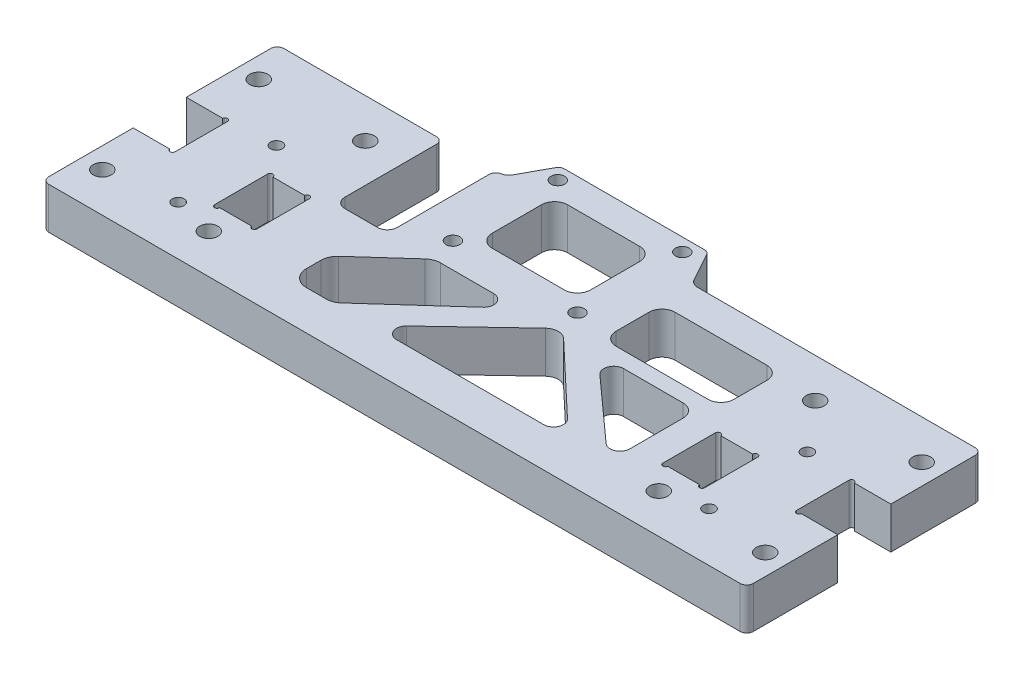
from build123d import *

# Parameters (mm, degrees)
SKETCH1_R           = 2.75
BOSS_EXTRUDE1_DEPTH = 12.7
SKETCH2_W           = 16
SKETCH2_H           = 46.496113018
CUT_EXTRUDE1_DEPTH  = 231.724624824
SKETCH3_R           = 2.1
CUT_EXTRUDE2_DEPTH  = 231.724624824
CUT_EXTRUDE3_DEPTH  = 231.724624824
FILLET1_R           = 3
FILLET2_R           = 2
SKETCH6_R           = 1.8
CUT_EXTRUDE4_DEPTH  = 231.724624958


with BuildPart() as part:
    # Sketch1 → Boss-Extrude1 (new body)
    with BuildSketch(Plane(origin=(0, 0, 0), x_dir=(1, 0, 0), z_dir=(0, 1, 0))):
        with BuildLine():
            Line((0, 71.75), (69.5, 71.75))
            Line((69.5, 71.75), (75.5, 82.75))
            Line((75.5, 82.75), (120.5, 82.75))
            Line((120.5, 82.75), (126.5, 71.75))
            Line((126.5, 71.75), (215, 71.75))
            Line((215, 71.75), (215, 43.975))
            Line((215, 43.975), (203.881088693, 43.975))
            ThreePointArc((203.881088693, 43.975), (203.090544346, 44.652363805), (202.3, 43.975))
            Line((202.3, 43.975), (202.3, 27.775))
            ThreePointArc((202.3, 27.775), (203.090544346, 27.097636195), (203.881088693, 27.775))
            Line((203.881088693, 27.775), (215, 27.775))
            Line((215, 27.775), (215, 0))
            Line((215, 0), (107.5, 0))
            Line((107.5, 0), (0, 0))
            Line((0, 0), (0, 27.775))
            Line((0, 27.775), (11.118911307, 27.775))
            ThreePointArc((11.118911307, 27.775), (11.909455654, 27.097636195), (12.7, 27.775))
            Line((12.7, 27.775), (12.7, 43.975))
            ThreePointArc((12.7, 43.975), (11.909455654, 44.652363805), (11.118911307, 43.975))
            Line((11.118911307, 43.975), (0, 43.975))
            Line((0, 43.975), (0, 71.75))
        make_face()
        with Locations((38.85, 59.75)):
            Circle(SKETCH1_R, mode=Mode.SUBTRACT)
        with Locations((38.85, 12)):
            Circle(SKETCH1_R, mode=Mode.SUBTRACT)
        with Locations((176.15, 59.75)):
            Circle(SKETCH1_R, mode=Mode.SUBTRACT)
        with Locations((176.15, 12)):
            Circle(SKETCH1_R, mode=Mode.SUBTRACT)
        with Locations((6.35, 12)):
            Circle(SKETCH1_R, mode=Mode.SUBTRACT)
        with Locations((6.35, 59.75)):
            Circle(SKETCH1_R, mode=Mode.SUBTRACT)
        with Locations((208.65, 59.75)):
            Circle(SKETCH1_R, mode=Mode.SUBTRACT)
        with Locations((208.65, 12)):
            Circle(SKETCH1_R, mode=Mode.SUBTRACT)
        with BuildLine():
            Line((32.700387603, 36.1), (32.700387603, 19.9))
            ThreePointArc((32.700387603, 19.9), (33.500387603, 19.1), (34.300387603, 19.9))
            Line((34.300387603, 19.9), (44.006274607, 19.9))
            ThreePointArc((44.006274607, 19.9), (44.85009833, 19.201570193), (45.6, 20))
            Line((45.6, 20), (45.6, 36))
            ThreePointArc((45.6, 36), (44.85009833, 36.798429807), (44.006274607, 36.1))
            Line((44.006274607, 36.1), (34.300387603, 36.1))
            ThreePointArc((34.300387603, 36.1), (33.500387603, 36.9), (32.700387603, 36.1))
        make_face(mode=Mode.SUBTRACT)
        with BuildLine():
            Line((182.299612397, 36.1), (182.299612397, 19.9))
            ThreePointArc((182.299612397, 19.9), (181.499612397, 19.1), (180.699612397, 19.9))
            Line((180.699612397, 19.9), (170.993725393, 19.9))
            ThreePointArc((170.993725393, 19.9), (170.14990167, 19.201570193), (169.4, 20))
            Line((169.4, 20), (169.4, 36))
            ThreePointArc((169.4, 36), (170.14990167, 36.798429807), (170.993725393, 36.1))
            Line((170.993725393, 36.1), (180.699612397, 36.1))
            ThreePointArc((180.699612397, 36.1), (181.499612397, 36.9), (182.299612397, 36.1))
        make_face(mode=Mode.SUBTRACT)
    extrude(amount=BOSS_EXTRUDE1_DEPTH)

    # Sketch2 → Cut-Extrude1 (cut, through all)
    with BuildSketch(Plane(origin=(0, 12.7, 0), x_dir=(1, 0, 0), z_dir=(0, 1, 0))):
        with Locations((58.6, 61.998056509)):
            Rectangle(SKETCH2_W, SKETCH2_H)
    extrude(amount=-CUT_EXTRUDE1_DEPTH, mode=Mode.SUBTRACT)

    # Sketch3 → Cut-Extrude2 (cut, through all)
    with BuildSketch(Plane(origin=(0, 12.7, 0), x_dir=(1, 0, 0), z_dir=(0, 1, 0))):
        with Locations((78.6, 78.75)):
            Circle(SKETCH3_R)
        with Locations((78.6, 46.75)):
            Circle(SKETCH3_R)
        with Locations((116.6, 78.75)):
            Circle(SKETCH3_R)
        with Locations((116.6, 46.75)):
            Circle(SKETCH3_R)
    extrude(amount=-CUT_EXTRUDE2_DEPTH, mode=Mode.SUBTRACT)

    # Sketch5 → Cut-Extrude3 (cut, through all)
    with BuildSketch(Plane(origin=(0, 12.7, 0), x_dir=(1, 0, 0), z_dir=(0, 1, 0))):
        with BuildLine():
            Line((98.782125318, 39), (82.518680026, 39))
            ThreePointArc((82.518680026, 39), (80.72736119, 38.668102058), (79.173856368, 37.716470731))
            Line((79.173856368, 37.716470731), (65.279045214, 25.211140692))
            ThreePointArc((65.279045214, 25.211140692), (64.056368555, 23.528862886), (63.623868872, 21.494669961))
            Line((63.623868872, 21.494669961), (63.623868872, 17))
            ThreePointArc((63.623868872, 17), (65.088334966, 13.464466094), (68.623868872, 12))
            Line((68.623868872, 12), (74.681319974, 12))
            ThreePointArc((74.681319974, 12), (76.47263881, 12.331897942), (78.026143632, 13.283529269))
            Line((78.026143632, 13.283529269), (100.789019513, 33.770117561))
            ThreePointArc((100.789019513, 33.770117561), (101.582986553, 37.074791302), (98.782125318, 39))
        make_face()
        with BuildLine():
            Line((115.851322474, 37.77611222), (94.075922745, 17.179491723))
            ThreePointArc((94.075922745, 17.179491723), (93.350095678, 13.890602679), (96.13743089, 12))
            Line((96.13743089, 12), (141.06256911, 12))
            ThreePointArc((141.06256911, 12), (143.849904322, 13.890602679), (143.124077255, 17.179491723))
            Line((143.124077255, 17.179491723), (121.348677526, 37.77611222))
            ThreePointArc((121.348677526, 37.77611222), (118.6, 38.870123257), (115.851322474, 37.77611222))
        make_face()
        with BuildLine():
            Line((138.417874682, 39), (156.6, 39))
            ThreePointArc((156.6, 39), (159.428427125, 37.828427125), (160.6, 35))
            Line((160.6, 35), (160.6, 18.736087214))
            ThreePointArc((160.6, 18.736087214), (158.820515755, 15.995587024), (155.593105805, 16.506204775))
            Line((155.593105805, 16.506204775), (136.410980487, 33.770117561))
            ThreePointArc((136.410980487, 33.770117561), (135.617013447, 37.074791302), (138.417874682, 39))
        make_face()
        with BuildLine():
            Line((86.6, 73.75), (108.6, 73.75))
            ThreePointArc((108.6, 73.75), (111.428427125, 72.578427125), (112.6, 69.75))
            Line((112.6, 69.75), (112.6, 54.75))
            ThreePointArc((112.6, 54.75), (111.428427125, 51.921572875), (108.6, 50.75))
            Line((108.6, 50.75), (86.6, 50.75))
            ThreePointArc((86.6, 50.75), (83.771572875, 51.921572875), (82.6, 54.75))
            Line((82.6, 54.75), (82.6, 69.75))
            ThreePointArc((82.6, 69.75), (83.771572875, 72.578427125), (86.6, 73.75))
        make_face()
        with BuildLine():
            Line((131.4, 61.75), (159.4, 61.75))
            ThreePointArc((159.4, 61.75), (162.228427125, 60.578427125), (163.4, 57.75))
            Line((163.4, 57.75), (163.4, 47.75))
            ThreePointArc((163.4, 47.75), (162.228427125, 44.921572875), (159.4, 43.75))
            Line((159.4, 43.75), (131.4, 43.75))
            ThreePointArc((131.4, 43.75), (128.571572875, 44.921572875), (127.4, 47.75))
            Line((127.4, 47.75), (127.4, 57.75))
            ThreePointArc((127.4, 57.75), (128.571572875, 60.578427125), (131.4, 61.75))
        make_face()
    extrude(amount=-CUT_EXTRUDE3_DEPTH, mode=Mode.SUBTRACT)

    # Fillet1
    fillet1_edges = [part.edges().sort_by_distance(p)[0] for p in [
        (69.5, 6.35, -71.75),
        (66.6, 6.35, -38.75),
        (50.6, 6.35, -38.75),
        (126.5, 6.35, -71.75),
    ]]
    fillet(fillet1_edges, radius=FILLET1_R)

    # Fillet2
    fillet2_edges = [part.edges().sort_by_distance(p)[0] for p in [
        (215, 6.35, -71.75),
        (120.5, 6.35, -82.75),
        (75.5, 6.35, -82.75),
        (50.6, 6.35, -71.75),
        (66.6, 6.35, -71.75),
        (0, 6.35, -71.75),
        (215, 6.35, 0),
        (0, 6.35, 0),
    ]]
    fillet(fillet2_edges, radius=FILLET2_R)

    # Sketch6 → Cut-Extrude4 (cut, through all)
    with BuildSketch(Plane(origin=(0, 12.7, 0), x_dir=(1, 0, 0), z_dir=(0, 1, 0))):
        with Locations((188.5, 45)):
            Circle(SKETCH6_R)
        with Locations((188.5, 15)):
            Circle(SKETCH6_R)
        with Locations((26.5, 45)):
            Circle(SKETCH6_R)
        with Locations((26.5, 15)):
            Circle(SKETCH6_R)
    extrude(amount=-CUT_EXTRUDE4_DEPTH, mode=Mode.SUBTRACT)


solid = part.part
